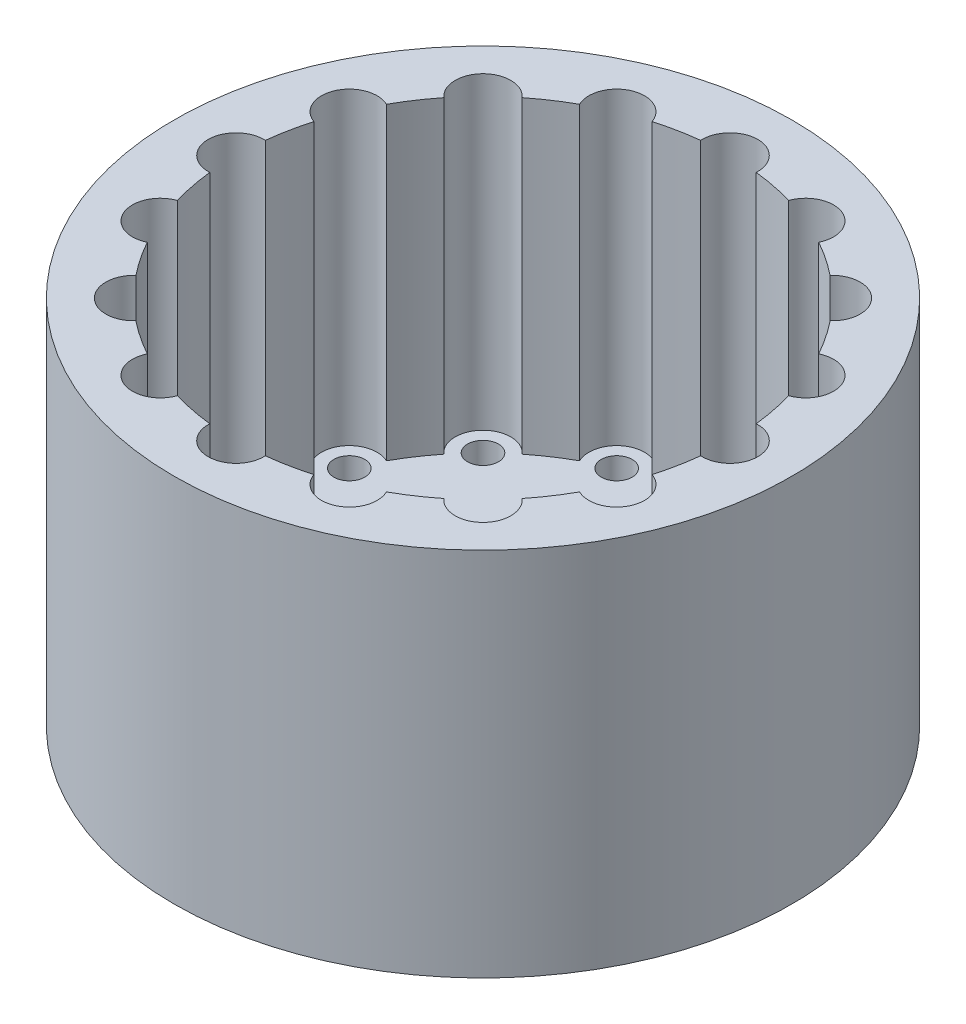
from build123d import *

# Parameters (mm, degrees)
SKETCH1_R           = 50
BOSS_EXTRUDE1_DEPTH = 50
BOSS_EXTRUDE2_START = 10
SKETCH2_R           = 50
BOSS_EXTRUDE2_DEPTH = 10
SKETCH3_R           = 2.5
CUT_EXTRUDE1_DEPTH  = 4


with BuildPart() as part:
    # Sketch1 → Boss-Extrude1 (new body)
    with BuildSketch(Plane(origin=(0, 0, 0), x_dir=(1, 0, 0), z_dir=(0, 1, 0))):
        Circle(SKETCH1_R)
        with BuildLine():
            ThreePointArc((-38.440673204, 11.059595094), (-39.231411216, 7.803612881), (-39.746875, 4.492875219))
            ThreePointArc((-39.746875, 4.492875219), (-44.5, 0), (-39.746875, -4.492875219))
            ThreePointArc((-39.746875, -4.492875219), (-39.231411216, -7.803612881), (-38.440673204, -11.059595094))
            ThreePointArc((-38.440673204, -11.059595094), (-41.112639197, -17.02941274), (-35.001975384, -19.361346008))
            ThreePointArc((-35.001975384, -19.361346008), (-33.258784492, -22.222809321), (-31.282227378, -24.928342309))
            ThreePointArc((-31.282227378, -24.928342309), (-31.466251763, -31.466251763), (-24.928342309, -31.282227378))
            ThreePointArc((-24.928342309, -31.282227378), (-22.222809321, -33.258784492), (-19.361346008, -35.001975384))
            ThreePointArc((-19.361346008, -35.001975384), (-17.02941274, -41.112639197), (-11.059595094, -38.440673204))
            ThreePointArc((-11.059595094, -38.440673204), (-7.803612881, -39.231411216), (-4.492875219, -39.746875))
            ThreePointArc((-4.492875219, -39.746875), (0, -44.5), (4.492875219, -39.746875))
            ThreePointArc((4.492875219, -39.746875), (7.803612881, -39.231411216), (11.059595094, -38.440673204))
            ThreePointArc((11.059595094, -38.440673204), (17.02941274, -41.112639197), (19.361346008, -35.001975384))
            ThreePointArc((19.361346008, -35.001975384), (22.222809321, -33.258784492), (24.928342309, -31.282227378))
            ThreePointArc((24.928342309, -31.282227378), (31.466251763, -31.466251763), (31.282227378, -24.928342309))
            ThreePointArc((31.282227378, -24.928342309), (33.258784492, -22.222809321), (35.001975384, -19.361346008))
            ThreePointArc((35.001975384, -19.361346008), (41.112639197, -17.02941274), (38.440673204, -11.059595094))
            ThreePointArc((38.440673204, -11.059595094), (39.231411216, -7.803612881), (39.746875, -4.492875219))
            ThreePointArc((39.746875, -4.492875219), (44.5, 0), (39.746875, 4.492875219))
            ThreePointArc((39.746875, 4.492875219), (39.231411216, 7.803612881), (38.440673204, 11.059595094))
            ThreePointArc((38.440673204, 11.059595094), (41.112639197, 17.02941274), (35.001975384, 19.361346008))
            ThreePointArc((35.001975384, 19.361346008), (33.258784492, 22.222809321), (31.282227378, 24.928342309))
            ThreePointArc((31.282227378, 24.928342309), (31.466251763, 31.466251763), (24.928342309, 31.282227378))
            ThreePointArc((24.928342309, 31.282227378), (22.222809321, 33.258784492), (19.361346008, 35.001975384))
            ThreePointArc((19.361346008, 35.001975384), (17.02941274, 41.112639197), (11.059595094, 38.440673204))
            ThreePointArc((11.059595094, 38.440673204), (7.803612881, 39.231411216), (4.492875219, 39.746875))
            ThreePointArc((4.492875219, 39.746875), (0, 44.5), (-4.492875219, 39.746875))
            ThreePointArc((-4.492875219, 39.746875), (-7.803612881, 39.231411216), (-11.059595094, 38.440673204))
            ThreePointArc((-11.059595094, 38.440673204), (-17.02941274, 41.112639197), (-19.361346008, 35.001975384))
            ThreePointArc((-19.361346008, 35.001975384), (-22.222809321, 33.258784492), (-24.928342309, 31.282227378))
            ThreePointArc((-24.928342309, 31.282227378), (-31.466251763, 31.466251763), (-31.282227378, 24.928342309))
            ThreePointArc((-31.282227378, 24.928342309), (-33.258784492, 22.222809321), (-35.001975384, 19.361346008))
            ThreePointArc((-35.001975384, 19.361346008), (-41.112639197, 17.02941274), (-38.440673204, 11.059595094))
        make_face(mode=Mode.SUBTRACT)
    extrude(amount=BOSS_EXTRUDE1_DEPTH)

    # Sketch2 → Boss-Extrude2 (add)
    with BuildSketch(Plane.XZ.offset(BOSS_EXTRUDE2_START)):
        Circle(SKETCH2_R)
    extrude(amount=-BOSS_EXTRUDE2_DEPTH)

    # Sketch3 → Cut-Extrude1 (cut)
    with BuildSketch(Plane(origin=(0, 0, 0), x_dir=(1, 0, 0), z_dir=(0, 1, 0))):
        with Locations((0, 40)):
            Circle(SKETCH3_R)
        with Locations((15.307337295, 36.9551813)):
            Circle(SKETCH3_R)
        with Locations((28.284271247, 28.284271247)):
            Circle(SKETCH3_R)
        with Locations((36.9551813, 15.307337295)):
            Circle(SKETCH3_R)
        with Locations((40, 0)):
            Circle(SKETCH3_R)
        with Locations((36.9551813, -15.307337295)):
            Circle(SKETCH3_R)
        with Locations((28.284271247, -28.284271247)):
            Circle(SKETCH3_R)
        with Locations((15.307337295, -36.9551813)):
            Circle(SKETCH3_R)
        with Locations((0, -40)):
            Circle(SKETCH3_R)
        with Locations((-15.307337295, -36.9551813)):
            Circle(SKETCH3_R)
        with Locations((-28.284271247, -28.284271247)):
            Circle(SKETCH3_R)
        with Locations((-36.9551813, -15.307337295)):
            Circle(SKETCH3_R)
        with Locations((-40, 0)):
            Circle(SKETCH3_R)
        with Locations((-36.9551813, 15.307337295)):
            Circle(SKETCH3_R)
        with Locations((-28.284271247, 28.284271247)):
            Circle(SKETCH3_R)
        with Locations((-15.307337295, 36.9551813)):
            Circle(SKETCH3_R)
    extrude(amount=-CUT_EXTRUDE1_DEPTH, mode=Mode.SUBTRACT)


solid = part.part
